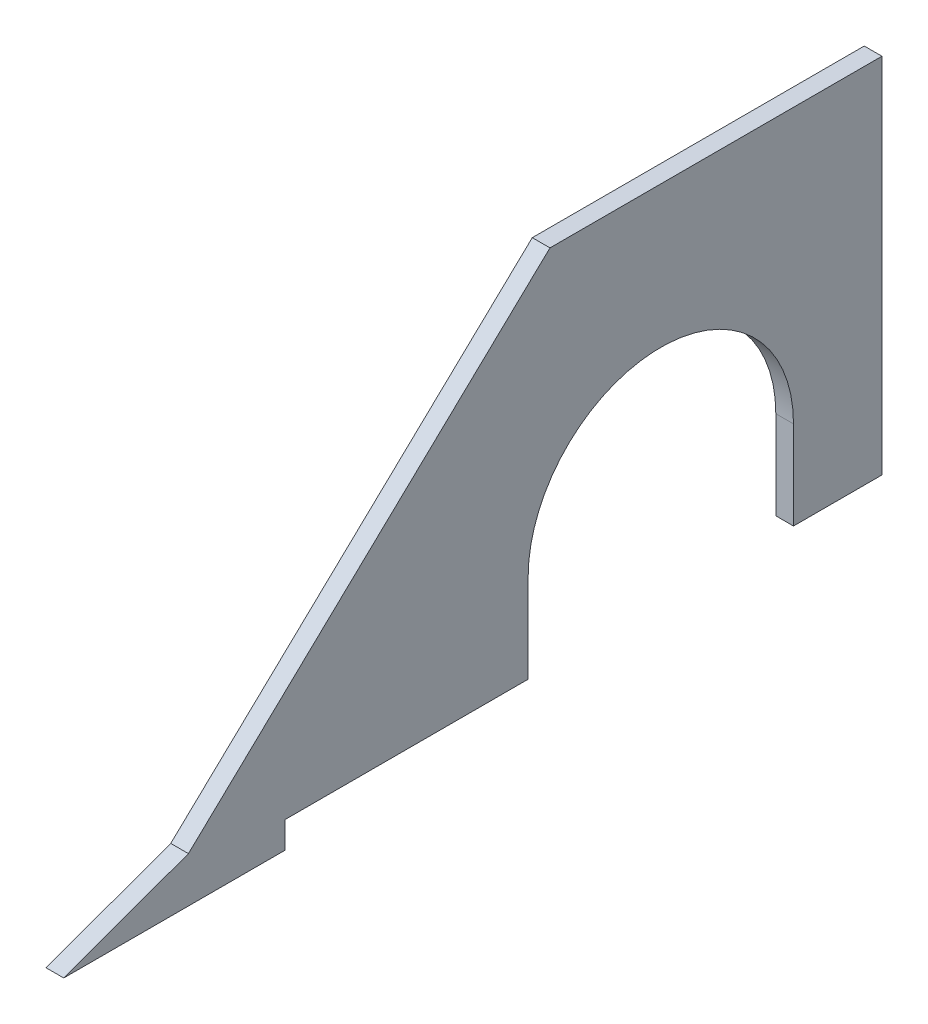
from build123d import *

# Parameters (mm, degrees)
SALIENTE_EXTRUIR2_DEPTH = 4
CORTAR_EXTRUIR1_DEPTH   = 4


with BuildPart() as part:
    # Croquis1 → Saliente-Extruir2 (new body)
    with BuildSketch(Plane(origin=(0, 0, 0), x_dir=(0, 0, -1), z_dir=(1, 0, 0))):
        Polygon((0, 0), (28.190778624, 10.2606043), (109.940300886, 88), (185, 88), (185, 6), (50, 6), (50, 0), align=None)
    extrude(amount=SALIENTE_EXTRUIR2_DEPTH)

    # Croquis2 → Cortar-Extruir1 (cut)
    with BuildSketch(Plane(origin=(4, 0, 0), x_dir=(0, 0, -1), z_dir=(1, 0, 0))):
        with BuildLine():
            Line((105, 6), (165, 6))
            Line((165, 6), (165, 26))
            ThreePointArc((165, 26), (135, 56), (105, 26))
            Line((105, 26), (105, 6))
        make_face()
    extrude(amount=-CORTAR_EXTRUIR1_DEPTH, mode=Mode.SUBTRACT)


solid = part.part
